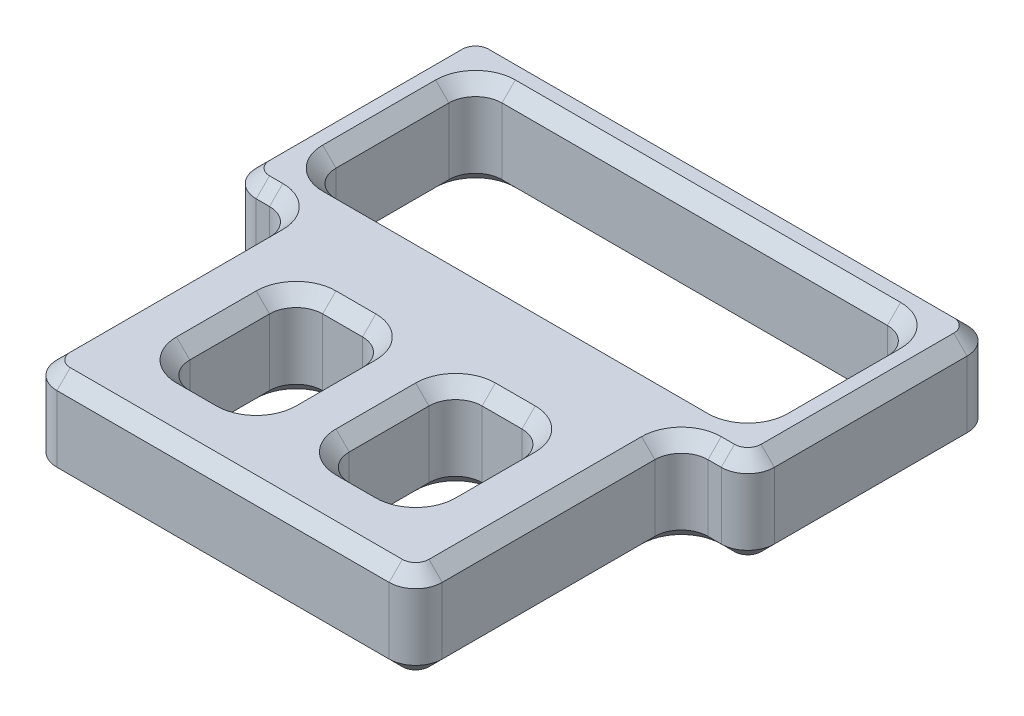
from build123d import *

# Parameters (mm, degrees)
SKETCH1_W           = 66
SKETCH1_H           = 25
SKETCH1_W_2         = 14
SKETCH1_H_2         = 20
BOSS_EXTRUDE1_DEPTH = 7
FILLET1_R           = 4
CHAMFER1_SIZE       = 2


with BuildPart() as part:
    # Sketch1 → Boss-Extrude1 (new, symmetric)
    with BuildSketch(Plane(origin=(0, 0, 0), x_dir=(1, 0, 0), z_dir=(0, 1, 0))):
        Polygon((-29, 20), (-39, 20), (-39, 57), (39, 57), (39, 20), (29, 20), (29, -20), (-29, -20), align=None)
        with Locations((0, 38.5)):
            Rectangle(SKETCH1_W, SKETCH1_H, mode=Mode.SUBTRACT)
        with Locations((-12, 0)):
            Rectangle(SKETCH1_W_2, SKETCH1_H_2, mode=Mode.SUBTRACT)
        with Locations((12, 0)):
            Rectangle(SKETCH1_W_2, SKETCH1_H_2, mode=Mode.SUBTRACT)
    extrude(amount=BOSS_EXTRUDE1_DEPTH, both=True)

    # Fillet1
    fillet1_edges = [part.edges().sort_by_distance(p)[0] for p in [
        (-33, 0, -26),
        (33, 0, -26),
        (33, 0, -51),
        (-33, 0, -51),
        (29, 0, 20),
        (-29, 0, 20),
        (-29, 0, -20),
        (-39, 0, -20),
        (-39, 0, -57),
        (39, 0, -57),
        (39, 0, -20),
        (29, 0, -20),
        (-19, 0, -10),
        (-5, 0, 10),
        (-5, 0, -10),
        (-19, 0, 10),
        (19, 0, 10),
        (19, 0, -10),
        (5, 0, -10),
        (5, 0, 10),
    ]]
    fillet(fillet1_edges, radius=FILLET1_R)

    # Chamfer1
    chamfer1_edges = [part.edges().sort_by_distance(p)[0] for p in [
        (-31.828427125, 7, -49.828427125),
        (-33, 7, -38.5),
        (-31.828427125, 7, -27.171572875),
        (0, 7, -26),
        (31.828427125, 7, -27.171572875),
        (33, 7, -38.5),
        (31.828427125, 7, -49.828427125),
        (0, 7, -51),
        (-27.828427125, 7, 18.828427125),
        (-29, 7, 0),
        (-30.171572875, 7, -18.828427125),
        (-34, 7, -20),
        (-37.828427125, 7, -21.171572875),
        (-39, 7, -38.5),
        (-37.828427125, 7, -55.828427125),
        (0, 7, -57),
        (37.828427125, 7, -55.828427125),
        (39, 7, -38.5),
        (37.828427125, 7, -21.171572875),
        (34, 7, -20),
        (30.171572875, 7, -18.828427125),
        (29, 7, 0),
        (27.828427125, 7, 18.828427125),
        (0, 7, 20),
        (-31.828427125, -7, -27.171572875),
        (-33, -7, -38.5),
        (-31.828427125, -7, -49.828427125),
        (0, -7, -51),
        (31.828427125, -7, -49.828427125),
        (33, -7, -38.5),
        (31.828427125, -7, -27.171572875),
        (0, -7, -26),
        (30.171572875, -7, -18.828427125),
        (34, -7, -20),
        (37.828427125, -7, -21.171572875),
        (39, -7, -38.5),
        (37.828427125, -7, -55.828427125),
        (0, -7, -57),
        (-37.828427125, -7, -55.828427125),
        (-39, -7, -38.5),
        (-37.828427125, -7, -21.171572875),
        (-34, -7, -20),
        (-30.171572875, -7, -18.828427125),
        (-29, -7, 0),
        (-27.828427125, -7, 18.828427125),
        (0, -7, 20),
        (27.828427125, -7, 18.828427125),
        (29, -7, 0),
        (19, 7, 0),
        (12, 7, -10),
        (5, 7, 0),
        (12, 7, 10),
        (-19, 7, 0),
        (-12, 7, 10),
        (-5, 7, 0),
        (-12, 7, -10),
        (12, -7, -10),
        (19, -7, 0),
        (12, -7, 10),
        (5, -7, 0),
        (-12, -7, 10),
        (-19, -7, 0),
        (-12, -7, -10),
        (-5, -7, 0),
        (17.828427125, 7, 8.828427125),
        (17.828427125, 7, -8.828427125),
        (6.171572875, 7, -8.828427125),
        (6.171572875, 7, 8.828427125),
        (-17.828427125, 7, -8.828427125),
        (-17.828427125, 7, 8.828427125),
        (-6.171572875, 7, 8.828427125),
        (-6.171572875, 7, -8.828427125),
        (17.828427125, -7, -8.828427125),
        (17.828427125, -7, 8.828427125),
        (6.171572875, -7, 8.828427125),
        (6.171572875, -7, -8.828427125),
        (-17.828427125, -7, 8.828427125),
        (-17.828427125, -7, -8.828427125),
        (-6.171572875, -7, -8.828427125),
        (-6.171572875, -7, 8.828427125),
    ]]
    chamfer(chamfer1_edges, length=CHAMFER1_SIZE)


solid = part.part
